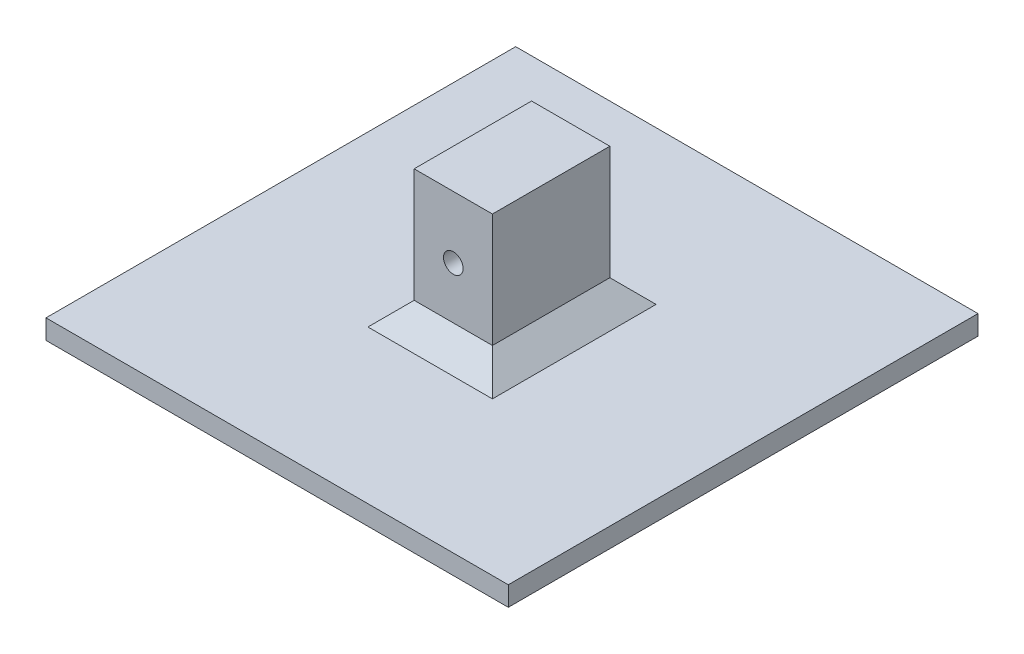
from build123d import *

# Parameters (mm, degrees)
BOSS_EXTRUDE1_DEPTH         = 12.7
BOSS_EXTRUDE1_DEPTH_BACK    = 12.7
F_1_4_0_25_DIAMETER_HOLE1_D = 6.35
BOSS_EXTRUDE2_DEPTH         = 75
BOSS_EXTRUDE2_DEPTH_BACK    = 75
SKETCH6_W                   = 152.4
SKETCH6_H                   = 6.35
CHAMFER1_SIZE               = 7.5


with BuildPart() as part:
    # Sketch-Profile → Boss-Extrude1 (new, two sides: drawn at the far end of the back side and taken through both)
    with BuildSketch(Plane(origin=(0, 0, 0), x_dir=(0, 0, -1), z_dir=(1, 0, 0)).offset(-BOSS_EXTRUDE1_DEPTH_BACK)):
        Polygon((-76.2, 6.35), (-76.2, 0), (76.2, 0), (76.2, 6.35), (19.05, 6.35), (19.05, 50.8), (-19.05, 50.8), (-19.05, 6.35), align=None)
    extrude(amount=BOSS_EXTRUDE1_DEPTH + BOSS_EXTRUDE1_DEPTH_BACK)

    # 1/4 (0.25) Diameter Hole1 (through all)
    with Locations(Plane.XY.offset(19.05)):
        with Locations((0, 30.6931)):
            Hole(F_1_4_0_25_DIAMETER_HOLE1_D / 2)

    # Sketch6 → Boss-Extrude2 (add, two sides: drawn at the far end of the back side and taken through both)
    with BuildSketch(Plane(origin=(0, 0, 0), x_dir=(0, 0, -1), z_dir=(1, 0, 0)).offset(-BOSS_EXTRUDE2_DEPTH_BACK)):
        with Locations((0, 3.175)):
            Rectangle(SKETCH6_W, SKETCH6_H)
    extrude(amount=BOSS_EXTRUDE2_DEPTH + BOSS_EXTRUDE2_DEPTH_BACK)

    # Chamfer1
    chamfer1_edges = [part.edges().sort_by_distance(p)[0] for p in [
        (0, 6.35, 19.05),
        (-12.7, 6.35, 0),
        (0, 6.35, -19.05),
        (12.7, 6.35, 0),
    ]]
    chamfer(chamfer1_edges, length=CHAMFER1_SIZE)


solid = part.part
